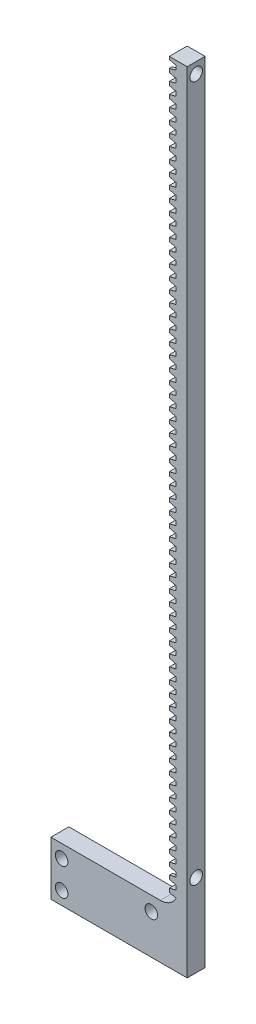
from build123d import *

# Parameters (mm, degrees)
EXTRUDE_1_DEPTH     = 5
SKETCH_2_R          = 1.75
CUT_EXTRUDE_1_DEPTH = 5
FILLET_1_R          = 5
SKETCH_3_R          = 1.75
CUT_EXTRUDE_2_DEPTH = 10


with BuildPart() as part:
    # 草图1 → 凸台-拉伸1 (new body)
    with BuildSketch(Plane.XY):
        Polygon((0, 0), (-38, 0), (-38, 15), (-3.0528, 15), (-3.0528, 16.547763568), (-3.0528, 17.700015932), (-5, 18.203596092), (-5, 19.185776058), (-3.0528, 19.689356218), (-3.0528, 20.841608582), (-5, 21.345188742), (-5, 22.327368708), (-3.0528, 22.830948868), (-3.0528, 23.983201232), (-5, 24.486781392), (-5, 25.468961358), (-3.0528, 25.972541518), (-3.0528, 27.124793882), (-5, 27.628374042), (-5, 28.610554008), (-3.0528, 29.114134168), (-3.0528, 30.266386532), (-5, 30.769966692), (-5, 31.752146658), (-3.0528, 32.255726818), (-3.0528, 33.407979182), (-5, 33.911559342), (-5, 34.893739308), (-3.0528, 35.397319468), (-3.0528, 36.549571832), (-5, 37.053151992), (-5, 38.035331958), (-3.0528, 38.538912118), (-3.0528, 39.691164482), (-5, 40.194744642), (-5, 41.176924608), (-3.0528, 41.680504768), (-3.0528, 42.832757132), (-5, 43.336337292), (-5, 44.318517258), (-3.0528, 44.822097418), (-3.0528, 45.974349782), (-5, 46.477929942), (-5, 47.460109908), (-3.0528, 47.963690068), (-3.0528, 49.115942432), (-5, 49.619522592), (-5, 50.601702558), (-3.0528, 51.105282718), (-3.0528, 52.257535082), (-5, 52.761115242), (-5, 53.743295208), (-3.0528, 54.246875368), (-3.0528, 55.399127732), (-5, 55.902707892), (-5, 56.884887858), (-3.0528, 57.388468018), (-3.0528, 58.540720382), (-5, 59.044300542), (-5, 60.026480508), (-3.0528, 60.530060668), (-3.0528, 61.682313032), (-5, 62.185893192), (-5, 63.168073158), (-3.0528, 63.671653318), (-3.0528, 64.823905682), (-5, 65.327485842), (-5, 66.309665808), (-3.0528, 66.813245968), (-3.0528, 67.965498332), (-5, 68.469078492), (-5, 69.451258458), (-3.0528, 69.954838618), (-3.0528, 71.107090982), (-5, 71.610671142), (-5, 72.592851108), (-3.0528, 73.096431268), (-3.0528, 74.248683632), (-5, 74.752263792), (-5, 75.734443758), (-3.0528, 76.238023918), (-3.0528, 77.390276282), (-5, 77.893856442), (-5, 78.876036408), (-3.0528, 79.379616568), (-3.0528, 80.531868932), (-5, 81.035449092), (-5, 82.017629058), (-3.0528, 82.521209218), (-3.0528, 83.673461582), (-5, 84.177041742), (-5, 85.159221708), (-3.0528, 85.662801868), (-3.0528, 86.815054232), (-5, 87.318634392), (-5, 88.300814358), (-3.0528, 88.804394518), (-3.0528, 89.956646882), (-5, 90.460227042), (-5, 91.442407008), (-3.0528, 91.945987168), (-3.0528, 93.098239532), (-5, 93.601819692), (-5, 94.583999658), (-3.0528, 95.087579818), (-3.0528, 96.239832182), (-5, 96.743412342), (-5, 97.725592308), (-3.0528, 98.229172468), (-3.0528, 99.381424832), (-5, 99.885004992), (-5, 100.867184958), (-3.0528, 101.370765118), (-3.0528, 102.523017482), (-5, 103.026597642), (-5, 104.008777608), (-3.0528, 104.512357768), (-3.0528, 105.664610132), (-5, 106.168190292), (-5, 107.150370258), (-3.0528, 107.653950418), (-3.0528, 108.806202782), (-5, 109.309782942), (-5, 110.291962908), (-3.0528, 110.795543068), (-3.0528, 111.947795432), (-5, 112.451375592), (-5, 113.433555558), (-3.0528, 113.937135718), (-3.0528, 115.089388082), (-5, 115.592968242), (-5, 116.575148208), (-3.0528, 117.078728368), (-3.0528, 118.230980732), (-5, 118.734560892), (-5, 119.716740858), (-3.0528, 120.220321018), (-3.0528, 121.372573382), (-5, 121.876153542), (-5, 122.858333508), (-3.0528, 123.361913668), (-3.0528, 124.514166032), (-5, 125.017746192), (-5, 125.999926158), (-3.0528, 126.503506318), (-3.0528, 127.655758682), (-5, 128.159338842), (-5, 129.141518808), (-3.0528, 129.645098968), (-3.0528, 130.797351332), (-5, 131.300931492), (-5, 132.283111458), (-3.0528, 132.786691618), (-3.0528, 133.938943982), (-5, 134.442524142), (-5, 135.424704108), (-3.0528, 135.928284268), (-3.0528, 137.080536632), (-5, 137.584116792), (-5, 138.566296758), (-3.0528, 139.069876918), (-3.0528, 140.222129282), (-5, 140.725709442), (-5, 141.707889408), (-3.0528, 142.211469568), (-3.0528, 143.363721932), (-5, 143.867302092), (-5, 144.849482058), (-3.0528, 145.353062218), (-3.0528, 146.505314582), (-5, 147.008894742), (-5, 147.991074708), (-3.0528, 148.494654868), (-3.0528, 149.646907232), (-5, 150.150487392), (-5, 151.132667358), (-3.0528, 151.636247518), (-3.0528, 152.788499882), (-5, 153.292080042), (-5, 154.274260008), (-3.0528, 154.777840168), (-3.0528, 155.930092532), (-5, 156.433672692), (-5, 157.415852658), (-3.0528, 157.919432818), (-3.0528, 159.071685182), (-5, 159.575265342), (-5, 160.557445308), (-3.0528, 161.061025468), (-3.0528, 162.213277832), (-5, 162.716857992), (-5, 163.699037958), (-3.0528, 164.202618118), (-3.0528, 165.354870482), (-5, 165.858450642), (-5, 166.840630608), (-3.0528, 167.344210768), (-3.0528, 168.496463132), (-5, 169.000043292), (-5, 169.982223258), (-3.0528, 170.485803418), (-3.0528, 171.638055782), (-5, 172.141635942), (-5, 173.123815908), (-3.0528, 173.627396068), (-3.0528, 174.779648432), (-5, 175.283228592), (-5, 176.265408558), (-3.0528, 176.768988718), (-3.0528, 177.921241082), (-5, 178.424821242), (-5, 179.407001208), (-3.0528, 179.910581368), (-3.0528, 181.062833732), (-5, 181.566413892), (-5, 182.548593858), (-3.0528, 183.052174018), (-3.0528, 184.204426382), (-5, 184.708006542), (-5, 185.690186508), (-3.0528, 186.193766668), (-3.0528, 187.346019032), (-5, 187.849599192), (-5, 188.831779158), (-3.0528, 189.335359318), (-3.0528, 190.487611682), (-5, 190.991191842), (-5, 191.973371808), (-3.0528, 192.476951968), (-3.0528, 193.629204332), (-5, 194.132784492), (-5, 195.114964458), (-3.0528, 195.618544618), (-3.0528, 196.770796982), (-5, 197.274377142), (-5, 198.256557108), (-3.0528, 198.760137268), (-3.0528, 199.912389632), (-5, 200.415969792), (-5, 201.398149758), (-3.0528, 201.901729918), (-3.0528, 203.053982282), (-5, 203.557562442), (-5, 204.539742408), (-3.0528, 205.043322568), (-3.0528, 206.195574932), (-5, 206.699155092), (-5, 207.681335058), (-3.0528, 208.184915218), (-3.0528, 209.337167582), (-5, 209.840747742), (-5, 210.822927708), (-3.0528, 211.326507868), (-3.0528, 212.478760232), (-5, 212.982340392), (-5, 213.964520358), (-3.0528, 214.468100518), (-3.0528, 215.620352882), (-5, 216.123933042), (-5, 217.106113008), (-3.0528, 217.609693168), (-3.0528, 218.761945532), (-5, 219.265525692), (-5, 220), (-3, 220), (0, 220), align=None)
    extrude(amount=EXTRUDE_1_DEPTH)

    # 草图2 → 切除-拉伸1 (cut)
    with BuildSketch(Plane.XY.offset(5)):
        with Locations((-35, 11.338545784)):
            Circle(SKETCH_2_R)
        with Locations(Location((-35, 3.661454216, 0), (0, 0, 180))):
            Circle(SKETCH_2_R)
        with Locations((15, 11)):
            Circle(SKETCH_2_R)
        with Locations((-10, 11)):
            Circle(SKETCH_2_R)
    extrude(amount=-CUT_EXTRUDE_1_DEPTH, mode=Mode.SUBTRACT)

    # 圆角1
    # the kernel refuses this fillet: 5 mm, written as the material it adds along each edge
    with BuildSketch(Plane(origin=(-3.0528, 15, 0), x_dir=(-1, 0, 0), z_dir=(0, 0, 1))) as fillet_1_piece_1:
        with BuildLine():
            CenterArc((4.43960283, -5), FILLET_1_R, 90, 62.61309811)
            Line((0, -2.700015932), (-0.088792057, -2.654016251))
            ThreePointArc((-0.088792057, -2.654016251), (-0.1, -1.350007966), (-0.1, 0))
            Line((-0.1, 0), (0, 0.1))
            Line((0, 0.1), (4.43960283, 0.1))
            Line((4.43960283, 0.1), (4.43960283, 0))
        make_face()
    extrude(amount=5)

    # 草图3 → 切除-拉伸2 (cut)
    with BuildSketch(Plane(origin=(0, 0, 0), x_dir=(0, 0, -1), z_dir=(1, 0, 0))):
        with Locations(Location((-2.5, 23, 0), (0, 0, 90))):
            Circle(SKETCH_3_R)
        with Locations(Location((-2.5, 217, 0), (0, 0, 90))):
            Circle(SKETCH_3_R)
    extrude(amount=-CUT_EXTRUDE_2_DEPTH, mode=Mode.SUBTRACT)


solid = part.part
